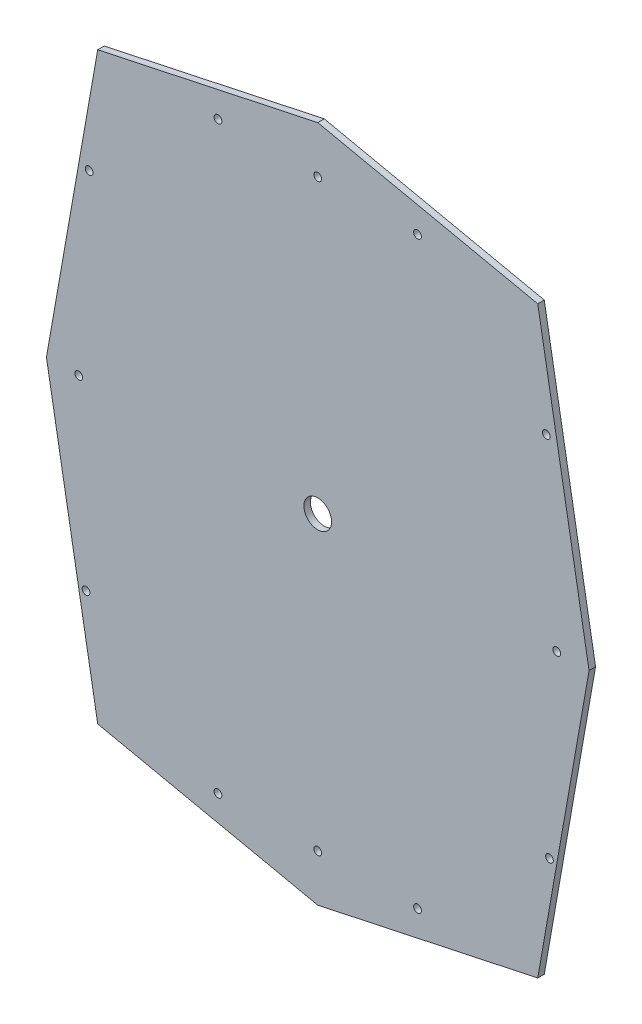
from build123d import *

# Parameters (mm, degrees)
SKETCH1_R      = 6.765949911
SKETCH1_R_2    = 1.89865
SKETCH1_R_3    = 1.869185851
MAINBODY_DEPTH = 3.175


with BuildPart() as part:
    # Sketch1 → MainBody (new body)
    with BuildSketch(Plane.XY):
        Polygon((-107.5, 142.639876692), (-132.56321938, 0), (-107.5, -142.639876692), (0, -165.569938346), (107.5, -142.639876692), (132.56321938, 0), (107.5, 142.639876692), (0, 165.569938346), align=None)
        Circle(SKETCH1_R, mode=Mode.SUBTRACT)
        with Locations((48.75, -142.639876692)):
            Circle(SKETCH1_R_2, mode=Mode.SUBTRACT)
        with Locations((0, -142.639876692)):
            Circle(SKETCH1_R_2, mode=Mode.SUBTRACT)
        with Locations((-48.75, -142.639876692)):
            Circle(SKETCH1_R_2, mode=Mode.SUBTRACT)
        with Locations((-113.226895498, -89.153367391)):
            Circle(SKETCH1_R_2, mode=Mode.SUBTRACT)
        with Locations((-116.750007419, 0.165666821)):
            Circle(SKETCH1_R_2, mode=Mode.SUBTRACT)
        with Locations((-111.690160304, 89.410835528)):
            Circle(SKETCH1_R_2, mode=Mode.SUBTRACT)
        with Locations((111.690160304, 89.410835528)):
            Circle(SKETCH1_R_2, mode=Mode.SUBTRACT)
        with Locations((116.750007419, 0.165666821)):
            Circle(SKETCH1_R_2, mode=Mode.SUBTRACT)
        with Locations((113.226895498, -89.153367391)):
            Circle(SKETCH1_R_3, mode=Mode.SUBTRACT)
        with Locations((48.75, 142.639876692)):
            Circle(SKETCH1_R_2, mode=Mode.SUBTRACT)
        with Locations((0, 142.639876692)):
            Circle(SKETCH1_R_2, mode=Mode.SUBTRACT)
        with Locations((-48.75, 142.639876692)):
            Circle(SKETCH1_R_2, mode=Mode.SUBTRACT)
    extrude(amount=MAINBODY_DEPTH)


solid = part.part
